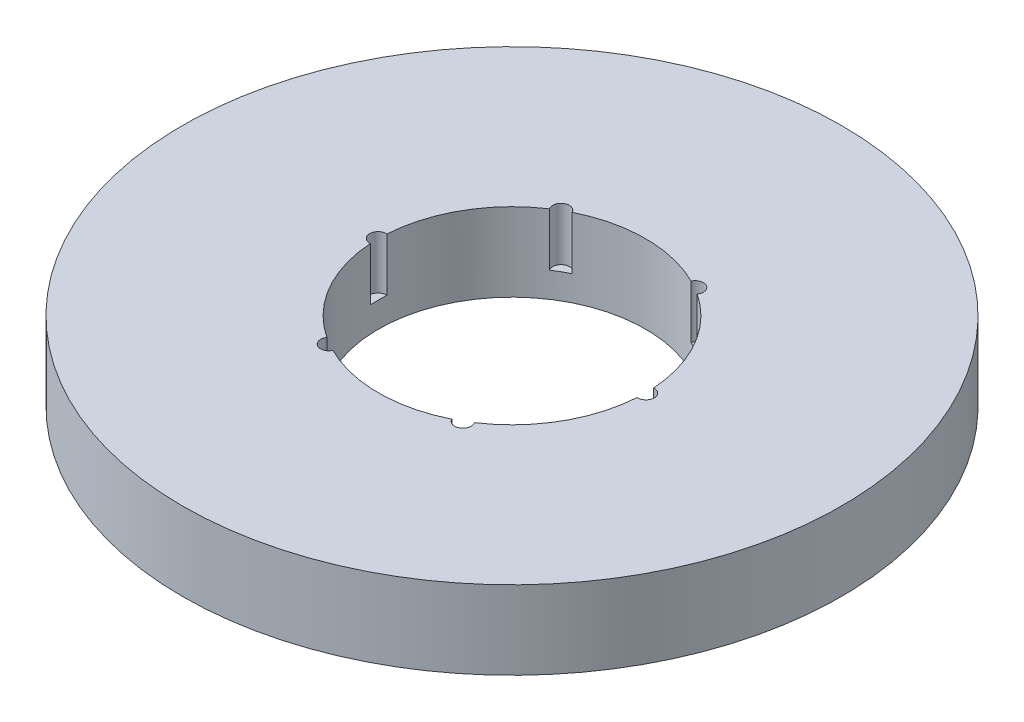
from build123d import *

# Parameters (mm, degrees)
SKETCH1_R           = 92.5
BOSS_EXTRUDE1_DEPTH = 22
SKETCH2_R           = 37.5
CUT_EXTRUDE1_DEPTH  = 133.651799837
SKETCH3_R           = 2.329210113
CUT_EXTRUDE2_DEPTH  = 14.91724955
CIRPATTERN1_COUNT   = 6


with BuildPart() as part:
    # Sketch1 → Boss-Extrude1 (new body)
    with BuildSketch(Plane(origin=(0, 0, 0), x_dir=(1, 0, 0), z_dir=(0, 1, 0))):
        Circle(SKETCH1_R)
    extrude(amount=BOSS_EXTRUDE1_DEPTH)

    # Sketch2 → Cut-Extrude1 (cut, through all)
    with BuildSketch(Plane(origin=(0, 0, 0), x_dir=(1, 0, 0), z_dir=(0, 1, 0))):
        Circle(SKETCH2_R)
    extrude(amount=CUT_EXTRUDE1_DEPTH, mode=Mode.SUBTRACT)

    # Sketch3 → Cut-Extrude2 (cut)
    with BuildSketch(Plane(origin=(0, 22, 0), x_dir=(1, 0, 0), z_dir=(0, 1, 0))):
        with Locations((-37.609768481, 0)):
            Circle(SKETCH3_R)
    cut_extrude2 = extrude(amount=-CUT_EXTRUDE2_DEPTH, mode=Mode.SUBTRACT)

    # CirPattern1: Cut-Extrude2 ×6 about axis
    cirpattern1_axis = Axis((0, 0, 0), (0, 1, 0))
    for i in range(1, CIRPATTERN1_COUNT):
        add(cut_extrude2.rotate(cirpattern1_axis, i * 360 / CIRPATTERN1_COUNT), mode=Mode.SUBTRACT)


solid = part.part
